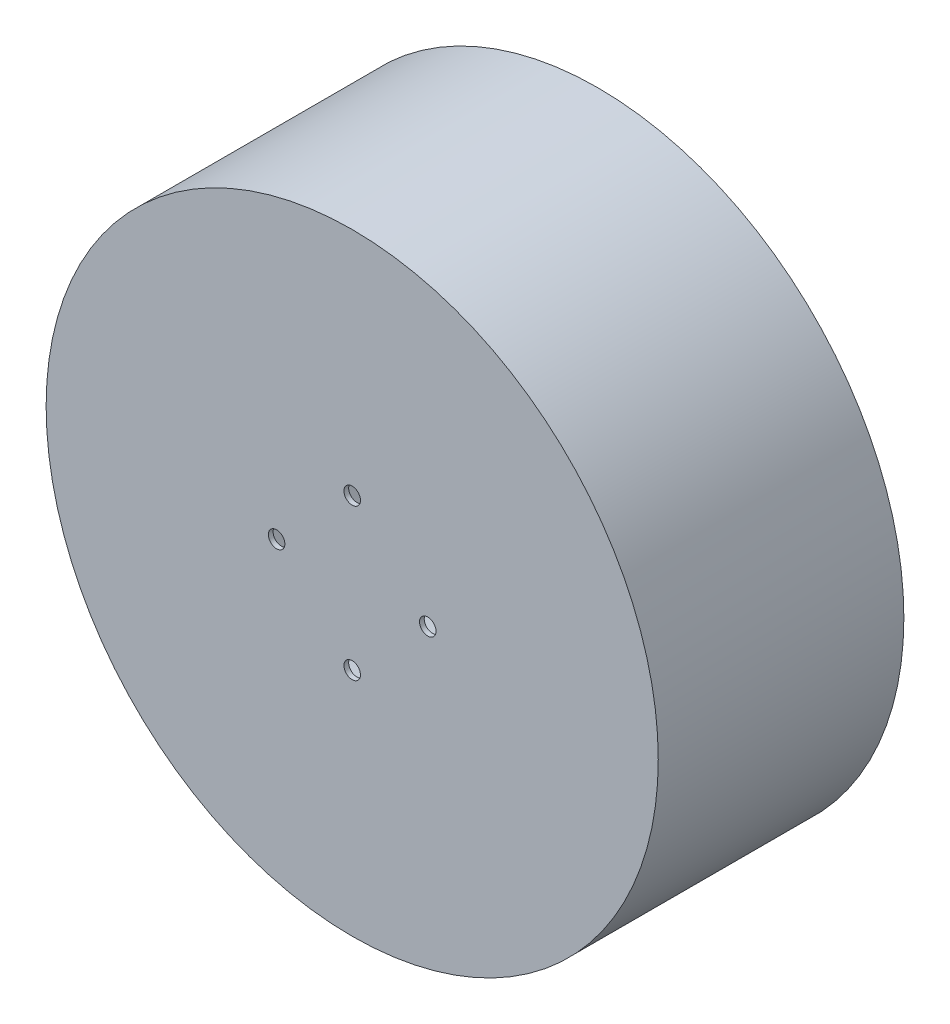
from build123d import *

# Parameters (mm, degrees)
SKETCH1_R           = 101.6
SKETCH1_R_2         = 5.55625
BOSS_EXTRUDE2_DEPTH = 3.175
BOSS_EXTRUDE3_START = -165.1
SKETCH2_R           = 205.74
SKETCH2_R_2         = 101.6
BOSS_EXTRUDE3_DEPTH = 165.1


with BuildPart() as part:
    # Sketch1 → Boss-Extrude2 (new body)
    with BuildSketch(Plane.XY):
        Circle(SKETCH1_R)
        with Locations((0, 50.8)):
            Circle(SKETCH1_R_2, mode=Mode.SUBTRACT)
        with Locations((50.8, 0)):
            Circle(SKETCH1_R_2, mode=Mode.SUBTRACT)
        with Locations((0, -50.8)):
            Circle(SKETCH1_R_2, mode=Mode.SUBTRACT)
        with Locations((-50.8, 0)):
            Circle(SKETCH1_R_2, mode=Mode.SUBTRACT)
    extrude(amount=BOSS_EXTRUDE2_DEPTH)

    # Sketch2 → Boss-Extrude3 (add)
    with BuildSketch(Plane.XY.offset(3.175).offset(BOSS_EXTRUDE3_START)):
        Circle(SKETCH2_R)
        Circle(SKETCH2_R_2, mode=Mode.SUBTRACT)
    extrude(amount=BOSS_EXTRUDE3_DEPTH)


solid = part.part
